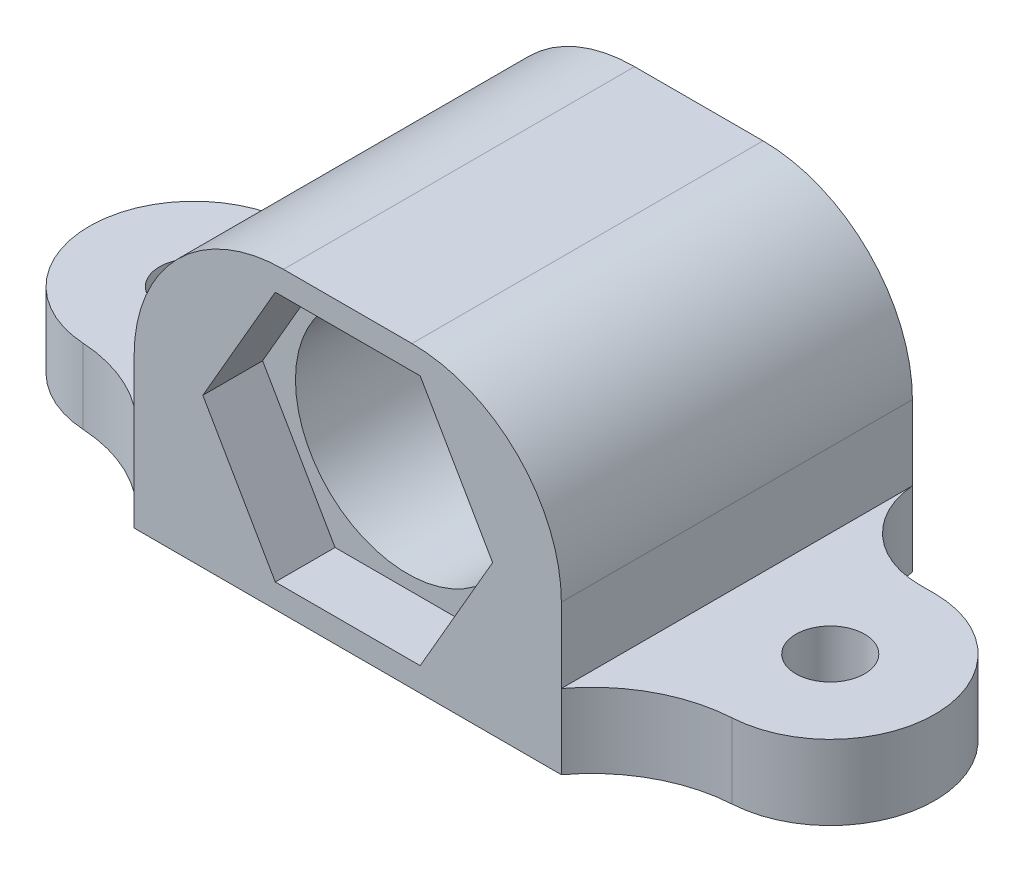
from build123d import *

# Parameters (mm, degrees)
SKETCH1_R                = 2.3
BOSS_EXTRUDE1_DEPTH      = 9.5
BOSS_EXTRUDE2_DEPTH      = 15
BOSS_EXTRUDE2_DEPTH_BACK = 9.5
SKETCH2_W                = 28.6
SKETCH2_H                = 19.5
SKETCH3_R                = 7.5
CUT_EXTRUDE1_DEPTH       = 59.657139378
FILLET1_R                = 10
FILLET2_R                = 6
CUT_EXTRUDE2_REACH       = 60.657
SKETCH5_W                = 56.6
SKETCH5_H                = 4.5
BOSS_EXTRUDE3_DEPTH      = 4
FILLET3_R                = 10


with BuildPart() as part:
    # Sketch1 → Boss-Extrude1 (new body)
    with BuildSketch(Plane(origin=(0, 0, 0), x_dir=(1, 0, 0), z_dir=(0, 1, 0))):
        with BuildLine():
            Line((0, 7), (42.6, 7))
            ThreePointArc((42.6, 7), (49.6, 0), (42.6, -7))
            Line((42.6, -7), (0, -7))
            ThreePointArc((0, -7), (-7, 0), (0, 7))
        make_face()
        with Locations(Location((0, 0, 0), (0, 0, 270))):
            Circle(SKETCH1_R, mode=Mode.SUBTRACT)
        with Locations(Location((42.6, 0, 0), (0, 0, 270))):
            Circle(SKETCH1_R, mode=Mode.SUBTRACT)
    extrude(amount=BOSS_EXTRUDE1_DEPTH)

    # Sketch2 → Boss-Extrude2 (add, two sides: drawn at the far end of the back side and taken through both)
    with BuildSketch(Plane(origin=(0, 9.5, 0), x_dir=(1, 0, 0), z_dir=(0, 1, 0)).offset(-BOSS_EXTRUDE2_DEPTH_BACK)):
        with Locations((21.3, 2.75)):
            Rectangle(SKETCH2_W, SKETCH2_H)
    extrude(amount=BOSS_EXTRUDE2_DEPTH + BOSS_EXTRUDE2_DEPTH_BACK)

    # Sketch3 → Cut-Extrude1 (cut, through all)
    with BuildSketch(Plane(origin=(0, 0, -12.5), x_dir=(-1, 0, 0), z_dir=(0, 0, -1))):
        with Locations((-21.3, 14.5)):
            Circle(SKETCH3_R)
    extrude(amount=-CUT_EXTRUDE1_DEPTH, mode=Mode.SUBTRACT)

    # Fillet1
    fillet1_edges = [part.edges().sort_by_distance(p)[0] for p in [
        (7, 24.5, -2.75),
        (35.6, 24.5, -2.75),
    ]]
    fillet(fillet1_edges, radius=FILLET1_R)

    # Fillet2
    # the kernel refuses this fillet: 6 mm, written as the material it adds along each edge
    with BuildSketch(Plane(origin=(7, 0, -7), x_dir=(0, 0, -1), z_dir=(0, 1, 0)), Plane(origin=(35.6, 9.5, -7), x_dir=(0, 0, -1), z_dir=(0, -1, 0))) as fillet2_piece_1:
        with BuildLine():
            CenterArc((6, 5.979130372), FILLET2_R, 180, 85.219808153)
            Line((0, 5.979130372), (-0.12, 5.979130372))
            Line((-0.12, 5.979130372), (-0.12, 0))
            Line((-0.12, 0), (0, -0.12))
            ThreePointArc((0, -0.12), (2.75, -0.12), (5.49, -0.119582607))
            Line((5.49, -0.119582607), (5.5, 0))
        make_face()
    extrude(amount=9.5)

    # Sketch5 → Cut-Extrude2 (cut, up to next)
    with BuildSketch(Plane(origin=(0, 0, -12.5), x_dir=(-1, 0, 0), z_dir=(0, 0, -1)), mode=Mode.PRIVATE) as cut_extrude2_sk1:
        with Locations((-21.3, 2.25)):
            Rectangle(SKETCH5_W, SKETCH5_H)
    cut_extrude2_tool1 = extrude(cut_extrude2_sk1.sketch, amount=-CUT_EXTRUDE2_REACH, mode=Mode.PRIVATE) & part.part
    add(cut_extrude2_tool1.solids().sort_by_distance((21.3, 2.25, -12.5))[0], mode=Mode.SUBTRACT)

    # Sketch10 → Boss-Extrude3 (add)
    with BuildSketch(Plane(origin=(0, 0, 7), x_dir=(-1, 0, 0), z_dir=(0, 0, -1))):
        with BuildLine():
            Line((-35.6, 4.5), (-35.6, 14.5))
            ThreePointArc((-35.6, 14.5), (-32.671067812, 21.571067812), (-25.6, 24.5))
            Line((-25.6, 24.5), (-17, 24.5))
            ThreePointArc((-17, 24.5), (-9.928932188, 21.571067812), (-7, 14.5))
            Line((-7, 14.5), (-7, 4.5))
            Line((-7, 4.5), (-35.6, 4.5))
        make_face()
        Polygon((-16.450257739, 22.9), (-26.149742261, 22.9), (-30.999484522, 14.5), (-26.149742261, 6.1), (-16.450257739, 6.1), (-11.600515478, 14.5), align=None, mode=Mode.SUBTRACT)
    extrude(amount=-BOSS_EXTRUDE3_DEPTH)

    # Fillet3
    # the kernel refuses this fillet: 10 mm, written as the material it adds along each edge
    with BuildSketch(Plane(origin=(7, 9.5, 7), x_dir=(-0.9999985389310836, 0, -0.0017094255462351089), z_dir=(0, -1, 0))) as fillet3_piece_1:
        with BuildLine():
            CenterArc((8.005961044, -9.982891134), FILLET3_R, 93.352047646, 49.900448128)
            Line((-0.006837702, -3.999994156), (-0.808117577, -3.401704458))
            ThreePointArc((-0.808117577, -3.401704458), (-1.00341739, -1.998287652), (-0.999998539, 0.001709426))
            Line((-0.999998539, 0.001709426), (0.001709426, 0.999998539))
            ThreePointArc((0.001709426, 0.999998539), (7.001699198, 0.98803256), (7.362781149, 0.998289113))
            Line((7.362781149, 0.998289113), (7.421252048, 0))
        make_face()
    extrude(amount=5)
    with BuildSketch(Plane(origin=(35.6, 4.5, 7), x_dir=(0, 0, 1), z_dir=(0, 1, 0))) as fillet3_piece_2:
        with BuildLine():
            CenterArc((9.969190954, 8.023014356), FILLET3_R, 183.449990563, 49.900448128)
            Line((-0.012686078, 7.421241205), (-1.010873781, 7.36106389))
            ThreePointArc((-1.010873781, 7.36106389), (-1, 7), (-1, 0))
            Line((-1, 0), (0, -1))
            ThreePointArc((0, -1), (2, -1), (3.403080905, -0.802301436))
            Line((3.403080905, -0.802301436), (4, 0))
        make_face()
    extrude(amount=5)


solid = part.part
